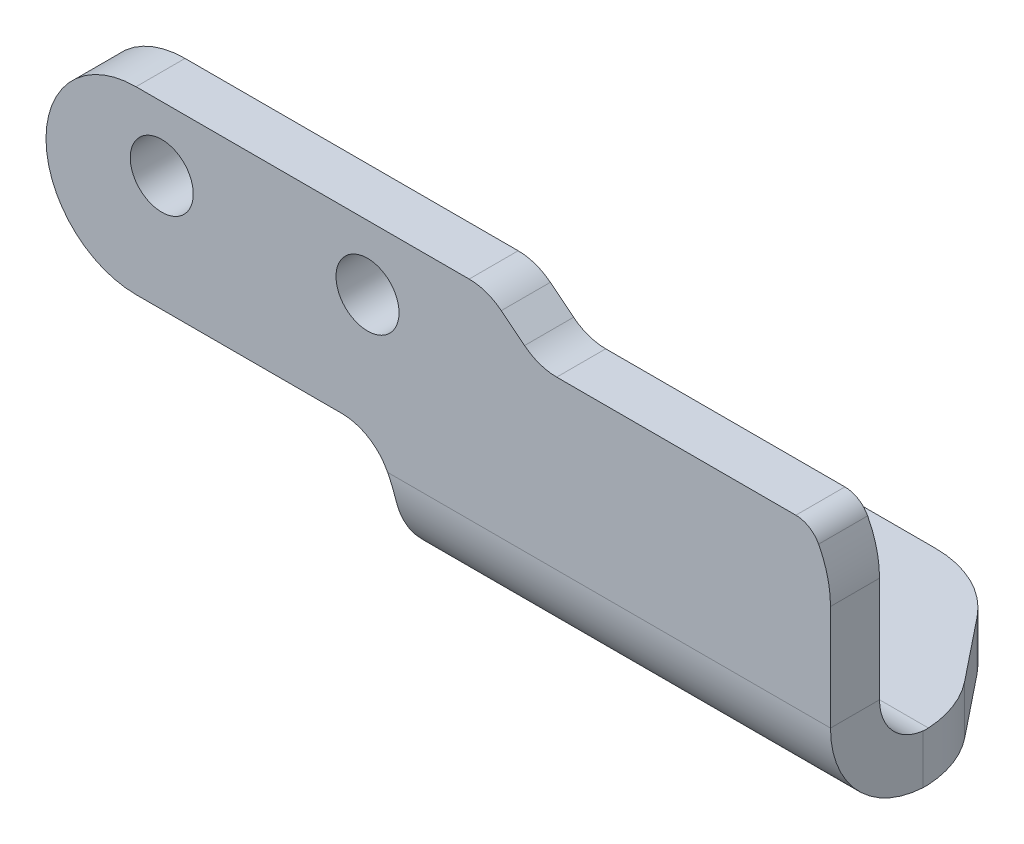
from build123d import *

# Parameters (mm, degrees)
CROQUIS1_R                       = 6.125
SALIENTE_EXTRUIR1_DEPTH          = 9.53
BRIDA_DE_ARISTA1_STRIP_W         = 57.18
BRIDA_DE_ARISTA1_STRIP_H         = 9.53
BRIDA_DE_ARISTA1_STRIP_CUT_DEPTH = 85
BRIDA_DE_ARISTA1_DEPTH           = 85
REDONDEO3_R                      = 10
CHAFL_N1_START                   = 111.176977613
CHAFL_N1_OUTLINE_W               = 35
CHAFL_N1_OUTLINE_H               = 9.53
CHAFL_N1_DEPTH                   = 16.823022387
REDONDEO4_R                      = 20


with BuildPart() as part:
    # Croquis1 → Saliente-Extruir1 (new body)
    with BuildSketch(Plane.XY):
        with BuildLine():
            Line((-5, 12.5), (59.758688568, 12.5))
            ThreePointArc((59.758688568, 12.5), (63.068757982, 11.936283192), (66.005639043, 10.308688094))
            Line((66.005639043, 10.308688094), (70.527359279, 6.691311906))
            ThreePointArc((70.527359279, 6.691311906), (73.464240341, 5.063716808), (76.774309755, 4.5))
            Line((76.774309755, 4.5), (123.266499161, 4.5))
            ThreePointArc((123.266499161, 4.5), (125.848488059, 3.781744193), (127.688665549, 1.833333333))
            ThreePointArc((127.688665549, 1.833333333), (129.41356885, -2.692366017), (130, -7.5))
            Line((130, -7.5), (130, -37.5))
            Line((130, -37.5), (45, -37.5))
            Line((45, -37.5), (45, -22.5))
            Line((45, -22.5), (-5, -22.5))
            ThreePointArc((-5, -22.5), (-22.5, -5), (-5, 12.5))
        make_face()
        Circle(CROQUIS1_R, mode=Mode.SUBTRACT)
        with Locations((40, 0)):
            Circle(CROQUIS1_R, mode=Mode.SUBTRACT)
    extrude(amount=SALIENTE_EXTRUIR1_DEPTH)

    # Brida de arista1: sheet metal written as solids
    # Brida de arista1 strip (on a plane across the edge) → Brida de arista1 strip cut (cut)
    with BuildSketch(Plane(origin=(130, -37.5, 0), x_dir=(0, 1, 0), z_dir=(-1, 0, 0))):
        with Locations((-19.06, -4.765)):
            Rectangle(BRIDA_DE_ARISTA1_STRIP_W, BRIDA_DE_ARISTA1_STRIP_H)
    extrude(amount=BRIDA_DE_ARISTA1_STRIP_CUT_DEPTH, mode=Mode.SUBTRACT)

    # Brida de arista1 section (on a plane across the edge) → Brida de arista1 (add)
    with BuildSketch(Plane(origin=(130, -37.5, 0), x_dir=(0, 1, 0), z_dir=(-1, 0, 0))):
        with BuildLine():
            Line((-9.53, 9.53), (-9.53, 40.47))
            Line((-9.53, 40.47), (0, 40.47))
            Line((0, 40.47), (0, 9.53))
            ThreePointArc((0, 9.53), (2.791272375, 2.791272375), (9.53, 0))
            Line((9.53, 0), (9.53, -9.53))
            ThreePointArc((9.53, -9.53), (-3.947455249, -3.947455249), (-9.53, 9.53))
        make_face()
    extrude(amount=BRIDA_DE_ARISTA1_DEPTH)

    # Redondeo3
    redondeo3_edges = [part.edges().sort_by_distance(p)[0] for p in [
        (45, -22.5, 4.765),
        (45, -42.265, -40.47),
    ]]
    fillet(redondeo3_edges, radius=REDONDEO3_R)

    # Chaflán1: read off the stored shape, not the designer's step
    # Chaflán1 outline → Chaflán1 (cut)
    with BuildSketch(Plane(origin=(0, 0, 0), x_dir=(0.6246950475544231, 0, 0.7808688094430313), z_dir=(0.7808688094430313, 0, -0.6246950475544232)).offset(CHAFL_N1_START)):
        with Locations((53.5, 42.265)):
            Rectangle(CHAFL_N1_OUTLINE_W, CHAFL_N1_OUTLINE_H)
    extrude(amount=CHAFL_N1_DEPTH, mode=Mode.SUBTRACT)

    # Redondeo4
    redondeo4_edges = [part.edges().sort_by_distance(p)[0] for p in [
        (110, -42.265, -40.47),
        (130, -42.265, -15.47),
    ]]
    fillet(redondeo4_edges, radius=REDONDEO4_R)


solid = part.part
